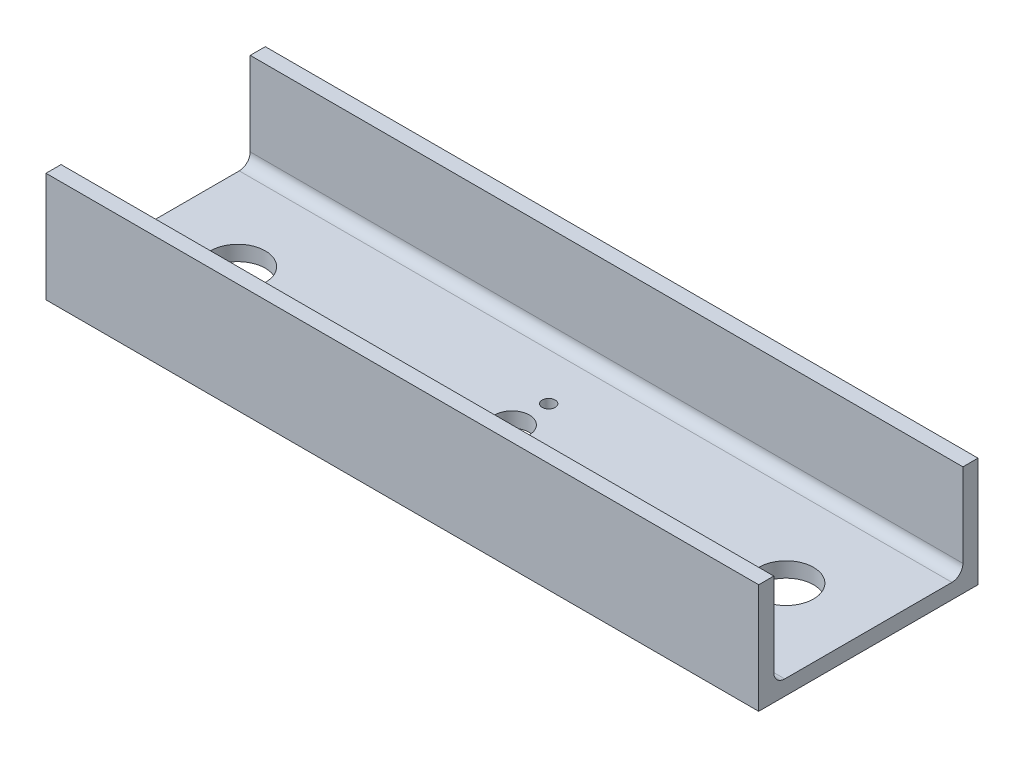
from build123d import *

# Parameters (mm, degrees)
BOSS_EXTRUDE1_DEPTH = 165.1
SKETCH2_R           = 6.35
SKETCH2_R_2         = 1.5
SKETCH2_R_3         = 4
CUT_EXTRUDE1_DEPTH  = 11.938


with BuildPart() as part:
    # Sketch1 → Boss-Extrude1 (new body)
    with BuildSketch(Plane(origin=(0, 0, 0), x_dir=(0, 0, -1), z_dir=(1, 0, 0))):
        with BuildLine():
            Line((-21.9075, -6.6675), (-21.9075, 9.2075))
            Line((-21.9075, 9.2075), (-21.9075, 12.7))
            Line((-21.9075, 12.7), (-25.4, 12.7))
            Line((-25.4, 12.7), (-25.4, -12.7))
            Line((-25.4, -12.7), (25.4, -12.7))
            Line((25.4, -12.7), (25.4, 12.7))
            Line((25.4, 12.7), (21.9075, 12.7))
            Line((21.9075, 12.7), (21.9075, 9.2075))
            Line((21.9075, 9.2075), (21.9075, -6.6675))
            ThreePointArc((21.9075, -6.6675), (21.163551224, -8.463551224), (19.3675, -9.2075))
            Line((19.3675, -9.2075), (-19.3675, -9.2075))
            ThreePointArc((-19.3675, -9.2075), (-21.163551224, -8.463551224), (-21.9075, -6.6675))
        make_face()
    extrude(amount=BOSS_EXTRUDE1_DEPTH)

    # Sketch2 → Cut-Extrude1 (cut)
    with BuildSketch(Plane.XZ.offset(12.7)):
        with Locations((19.05, 0)):
            Circle(SKETCH2_R)
        with Locations((146.05, 0)):
            Circle(SKETCH2_R)
        with Locations((82.55, 8.5)):
            Circle(SKETCH2_R_2)
        with Locations((82.55, -8.5)):
            Circle(SKETCH2_R_2)
        with Locations((82.55, 0)):
            Circle(SKETCH2_R_3)
    extrude(amount=-CUT_EXTRUDE1_DEPTH, mode=Mode.SUBTRACT)


solid = part.part
